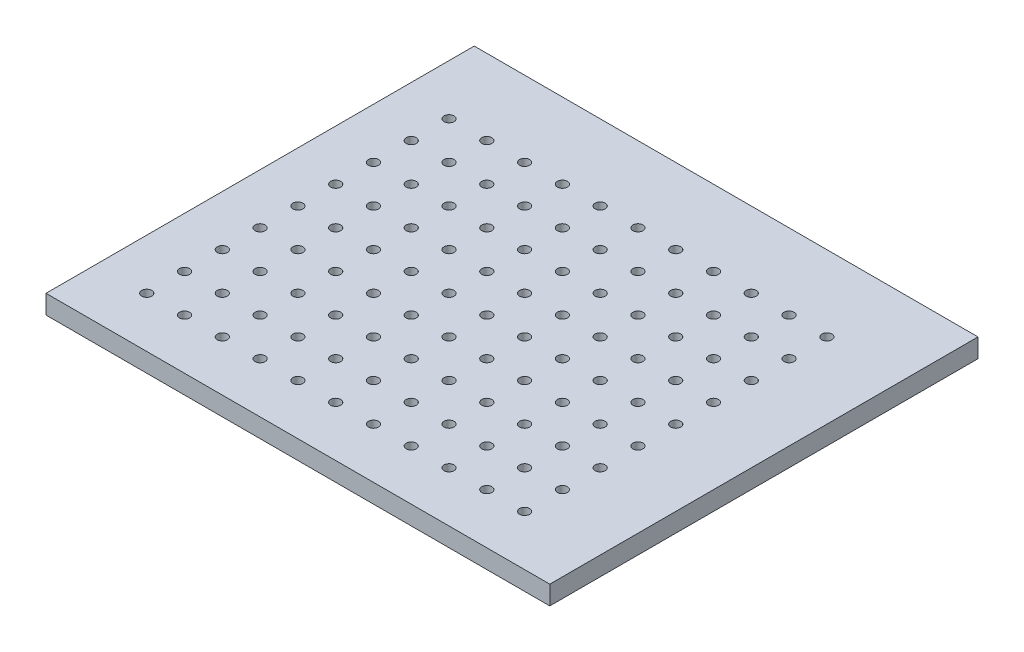
from build123d import *

# Parameters (mm, degrees)
ESBO_O1_W                 = 400
ESBO_O1_H                 = 340
RESSALTO_EXTRUS_O1_DEPTH  = 15
ESBO_O2_R                 = 4
CORTE_EXTRUS_O1_DEPTH     = 263.916336503
PADR_O_LINEAR1_COUNT      = 11
PADR_O_LINEAR1_PITCH      = 30
PADR_O_LINEAR1_COUNT_DIR2 = 9
PADR_O_LINEAR1_PITCH_DIR2 = 30


with BuildPart() as part:
    # Esboço1 → Ressalto-extrusão1 (new body)
    with BuildSketch(Plane(origin=(0, 0, 0), x_dir=(1, 0, 0), z_dir=(0, 1, 0))):
        Rectangle(ESBO_O1_W, ESBO_O1_H)
    extrude(amount=RESSALTO_EXTRUS_O1_DEPTH)

    # Esboço2 → Corte-extrusão1 (cut, through all)
    with BuildSketch(Plane(origin=(0, 15, 0), x_dir=(1, 0, 0), z_dir=(0, 1, 0))):
        with Locations((-160, -130)):
            Circle(ESBO_O2_R)
    corte_extrus_o1 = extrude(amount=-CORTE_EXTRUS_O1_DEPTH, mode=Mode.SUBTRACT)

    # Padrão linear1: Corte-extrus_o1 11 × 9
    with Locations(*[(i * PADR_O_LINEAR1_PITCH, 0, -j * PADR_O_LINEAR1_PITCH_DIR2) for i in range(PADR_O_LINEAR1_COUNT) for j in range(PADR_O_LINEAR1_COUNT_DIR2) if (i, j) != (0, 0)]):
        add(corte_extrus_o1, mode=Mode.SUBTRACT)


solid = part.part
